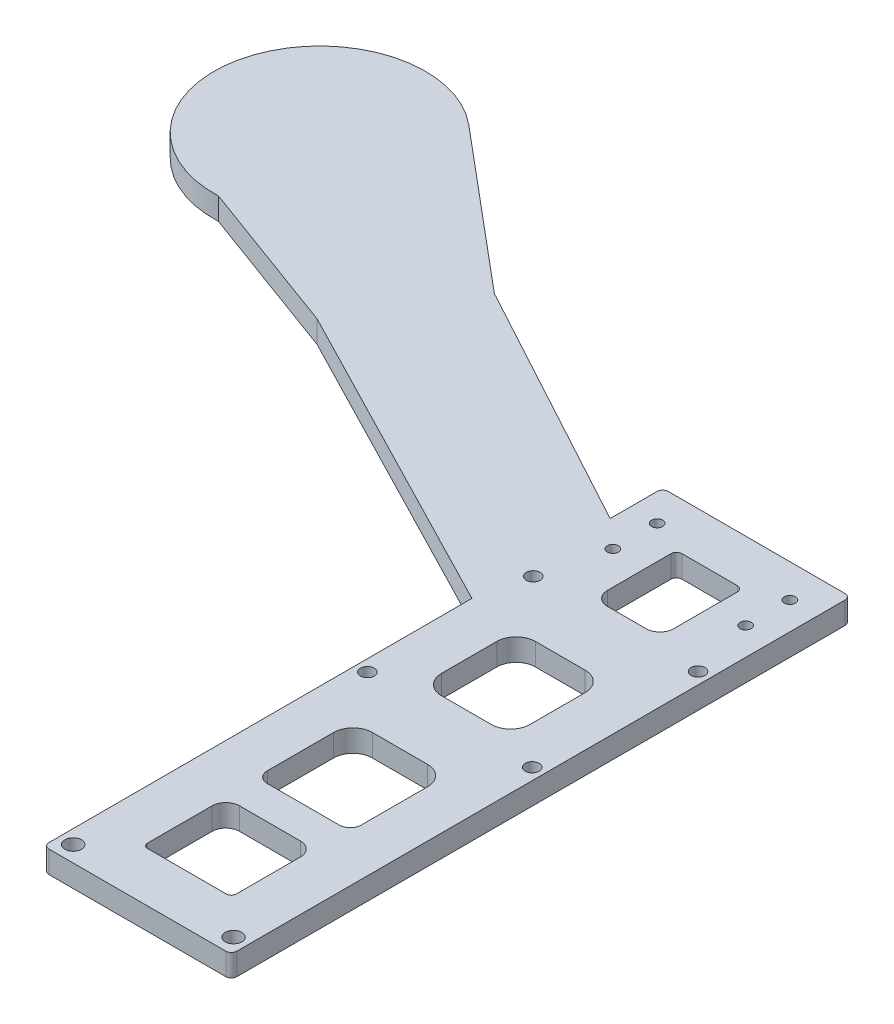
from build123d import *

# Parameters (mm, degrees)
FRAME_SKETCH_R           = 1.5
FRAME_SKETCH_R_2         = 1
FRAME_SKETCH_R_3         = 1.25
FRAME_BOTTOM_PLATE_DEPTH = 4


with BuildPart() as part:
    # Frame Sketch → Frame Bottom Plate (new body)
    # profile 1 of 2: a face of its own
    with BuildSketch(Plane(origin=(0, 0, 0), x_dir=(1, 0, 0), z_dir=(0, 1, 0))):
        with BuildLine():
            Line((-10.701916271, 46.640393786), (-56.419082435, 71.418220928))
            Line((-56.419082435, 71.418220928), (-85.145749052, 95.522756291))
            ThreePointArc((-85.145749052, 95.522756291), (-115.553099189, 87.033536705), (-96.643378751, 61.753183375))
            Line((-96.643378751, 61.753183375), (-68.479775444, 51.418220928))
            Line((-68.479775444, 51.418220928), (-10.701916271, 21.640393786))
            Line((-10.701916271, 21.640393786), (-10.701916271, 46.640393786))
        make_face()
    # profile 2 of 2: a face of its own
    with BuildSketch(Plane(origin=(0, 0, 0), x_dir=(1, 0, 0), z_dir=(0, 1, 0))):
        with BuildLine():
            Line((-9.701916271, 56.140393786), (22.298083729, 56.140393786))
            ThreePointArc((22.298083729, 56.140393786), (23.00519051, 55.847500567), (23.298083729, 55.140393786))
            Line((23.298083729, 55.140393786), (23.298083729, -54.859606214))
            ThreePointArc((23.298083729, -54.859606214), (23.00519051, -55.566712995), (22.298083729, -55.859606214))
            Line((22.298083729, -55.859606214), (-9.701916271, -55.859606214))
            ThreePointArc((-9.701916271, -55.859606214), (-10.409023052, -55.566712995), (-10.701916271, -54.859606214))
            Line((-10.701916271, -54.859606214), (-10.701916271, 55.140393786))
            ThreePointArc((-10.701916271, 55.140393786), (-10.409023052, 55.847500567), (-9.701916271, 56.140393786))
        make_face()
        with Locations((-8.201916271, -52.959606214)):
            Circle(FRAME_SKETCH_R, mode=Mode.SUBTRACT)
        with Locations((20.798083729, -52.959606214)):
            Circle(FRAME_SKETCH_R, mode=Mode.SUBTRACT)
        with Locations((18.298083729, 50.140393786)):
            Circle(FRAME_SKETCH_R_2, mode=Mode.SUBTRACT)
        with Locations((18.298083729, 42.140393786)):
            Circle(FRAME_SKETCH_R_2, mode=Mode.SUBTRACT)
        with Locations((-5.701916271, 50.140393786)):
            Circle(FRAME_SKETCH_R_2, mode=Mode.SUBTRACT)
        with Locations((-5.701916271, 42.140393786)):
            Circle(FRAME_SKETCH_R_2, mode=Mode.SUBTRACT)
        with Locations((-8.601916271, 30.640393786)):
            Circle(FRAME_SKETCH_R_3, mode=Mode.SUBTRACT)
        with Locations((-8.601916271, 0.640393786)):
            Circle(FRAME_SKETCH_R_3, mode=Mode.SUBTRACT)
        with Locations((21.198083729, 0.640393786)):
            Circle(FRAME_SKETCH_R_3, mode=Mode.SUBTRACT)
        with Locations((21.198083729, 30.640393786)):
            Circle(FRAME_SKETCH_R_3, mode=Mode.SUBTRACT)
        with BuildLine():
            Line((-0.842310056, -46.859606214), (13.438477515, -46.859606214))
            ThreePointArc((13.438477515, -46.859606214), (14.046310898, -46.607833383), (14.298083729, -46))
            Line((14.298083729, -46), (14.298083729, -34.359606214))
            ThreePointArc((14.298083729, -34.359606214), (13.565850682, -32.591839261), (11.798083729, -31.859606214))
            Line((11.798083729, -31.859606214), (0.798083729, -31.859606214))
            ThreePointArc((0.798083729, -31.859606214), (-0.969683224, -32.591839261), (-1.701916271, -34.359606214))
            Line((-1.701916271, -34.359606214), (-1.701916271, -46))
            ThreePointArc((-1.701916271, -46), (-1.45014344, -46.607833383), (-0.842310056, -46.859606214))
        make_face(mode=Mode.SUBTRACT)
        with BuildLine():
            Line((12.798083729, -25.859606214), (-0.201916271, -25.859606214))
            ThreePointArc((-0.201916271, -25.859606214), (-1.616129833, -25.273819777), (-2.201916271, -23.859606214))
            Line((-2.201916271, -23.859606214), (-2.201916271, -11.859606214))
            ThreePointArc((-2.201916271, -11.859606214), (-1.176790005, -9.38473248), (1.298083729, -8.359606214))
            Line((1.298083729, -8.359606214), (11.298083729, -8.359606214))
            ThreePointArc((11.298083729, -8.359606214), (13.772957463, -9.38473248), (14.798083729, -11.859606214))
            Line((14.798083729, -11.859606214), (14.798083729, -23.859606214))
            ThreePointArc((14.798083729, -23.859606214), (14.212297292, -25.273819777), (12.798083729, -25.859606214))
        make_face(mode=Mode.SUBTRACT)
        with BuildLine():
            Line((1.798083729, 3.640393786), (10.798083729, 3.640393786))
            ThreePointArc((10.798083729, 3.640393786), (13.272957463, 4.665520052), (14.298083729, 7.140393786))
            Line((14.298083729, 7.140393786), (14.298083729, 17.140393786))
            ThreePointArc((14.298083729, 17.140393786), (13.272957463, 19.61526752), (10.798083729, 20.640393786))
            Line((10.798083729, 20.640393786), (1.798083729, 20.640393786))
            ThreePointArc((1.798083729, 20.640393786), (-0.676790005, 19.61526752), (-1.701916271, 17.140393786))
            Line((-1.701916271, 17.140393786), (-1.701916271, 7.140393786))
            ThreePointArc((-1.701916271, 7.140393786), (-0.676790005, 4.665520052), (1.798083729, 3.640393786))
        make_face(mode=Mode.SUBTRACT)
        with BuildLine():
            Line((2.798083729, 32.640393786), (9.798083729, 32.640393786))
            ThreePointArc((9.798083729, 32.640393786), (11.565850682, 33.372626833), (12.298083729, 35.140393786))
            Line((12.298083729, 35.140393786), (12.298083729, 46.640393786))
            ThreePointArc((12.298083729, 46.640393786), (12.00519051, 47.347500567), (11.298083729, 47.640393786))
            Line((11.298083729, 47.640393786), (1.298083729, 47.640393786))
            ThreePointArc((1.298083729, 47.640393786), (0.590976948, 47.347500567), (0.298083729, 46.640393786))
            Line((0.298083729, 46.640393786), (0.298083729, 35.140393786))
            ThreePointArc((0.298083729, 35.140393786), (1.030316776, 33.372626833), (2.798083729, 32.640393786))
        make_face(mode=Mode.SUBTRACT)
    extrude(amount=FRAME_BOTTOM_PLATE_DEPTH)


solid = part.part
